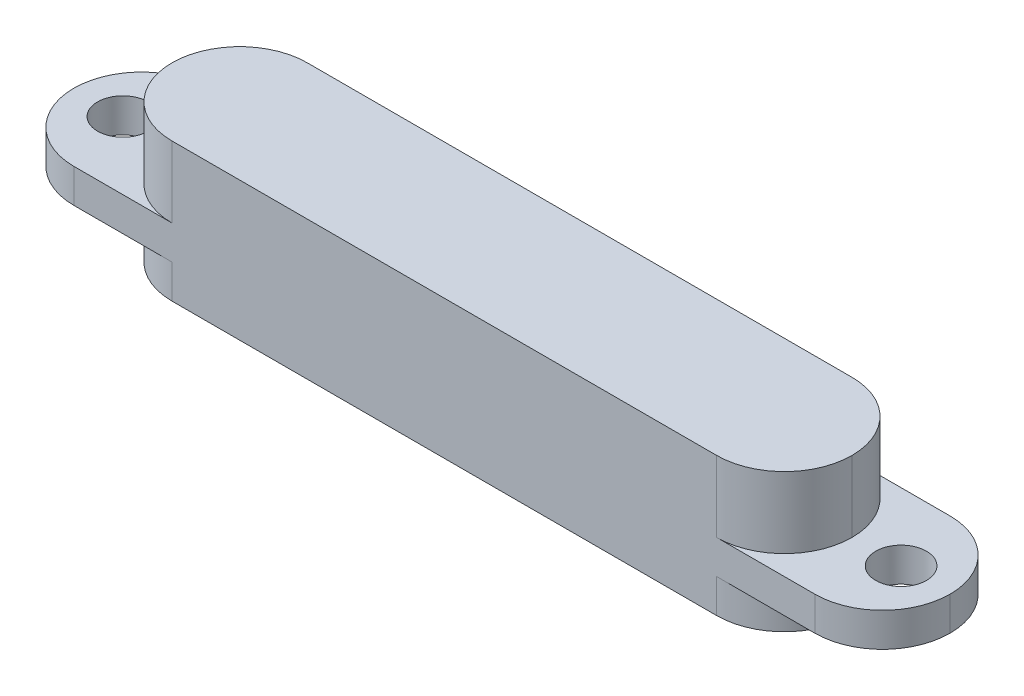
from build123d import *

# Parameters (mm, degrees)
SKETCH_1_W          = 20.1
SKETCH_1_H          = 4
EXTRUDE_1_DEPTH     = 2.1
SKETCH_1_3_W        = 25.9
SKETCH_1_3_H        = 4
EXTRUDE_2_DEPTH     = 1
EXTRUDE_START       = -1
SKETCH_1_4_W        = 20.1
SKETCH_1_4_H        = 4
EXTRUDE_4_DEPTH     = 1
FILLET_2_R          = 2
FILLET_1_R          = 2
SKETCH_2_R          = 0.75
CUT_EXTRUDE_1_DEPTH = 14.465233009
EXTRUDE_START_2     = -3.1
SKETCH_3_R          = 0.5
EXTRUDE_3_DEPTH     = 5.6


with BuildPart() as part:
    # 草图1 → 凸台-拉伸1 (new body)
    with BuildSketch(Plane(origin=(0, 0, 0), x_dir=(1, 0, 0), z_dir=(0, 1, 0))):
        Rectangle(SKETCH_1_W, SKETCH_1_H)
    extrude(amount=EXTRUDE_1_DEPTH)

    # 草图1<3> → 凸台-拉伸2 (add)
    with BuildSketch(Plane(origin=(0, 0, 0), x_dir=(1, 0, 0), z_dir=(0, 1, 0))):
        Rectangle(SKETCH_1_3_W, SKETCH_1_3_H)
    extrude(amount=-EXTRUDE_2_DEPTH)

    # 草图1<4> → 凸台-拉伸4 (add)
    with BuildSketch(Plane(origin=(0, 0, 0), x_dir=(1, 0, 0), z_dir=(0, 1, 0)).offset(EXTRUDE_START)):
        Rectangle(SKETCH_1_4_W, SKETCH_1_4_H)
    extrude(amount=-EXTRUDE_4_DEPTH)

    # 圆角2
    fillet_2_edges = [part.edges().sort_by_distance(p)[0] for p in [
        (12.95, -0.5, 2),
        (12.95, -0.5, -2),
        (-12.95, -0.5, 2),
        (-12.95, -0.5, -2),
    ]]
    fillet(fillet_2_edges, radius=FILLET_2_R - 0.0001)  # a hair under: the kernel refuses the full size

    # 圆角1
    fillet_1_edges = [part.edges().sort_by_distance(p)[0] for p in [
        (10.05, 1.05, -2),
        (10.05, 1.05, 2),
        (-10.05, 1.05, 2),
        (-10.05, 1.05, -2),
        (-10.05, -1.5, -2),
        (-10.05, -1.5, 2),
        (10.05, -1.5, 2),
        (10.05, -1.5, -2),
    ]]
    fillet(fillet_1_edges, radius=FILLET_1_R - 0.0001)  # a hair under: the kernel refuses the full size

    # 草图2 → 切除-拉伸1 (cut, through all)
    with BuildSketch(Plane(origin=(0, -1, 0), x_dir=(-1, 0, 0), z_dir=(0, -1, 0))):
        with Locations(Location((11.5, 0, 0), (0, 0, 90))):
            Circle(SKETCH_2_R)
        with Locations(Location((-11.5, 0, 0), (0, 0, 90))):
            Circle(SKETCH_2_R)
    extrude(amount=-CUT_EXTRUDE_1_DEPTH, mode=Mode.SUBTRACT)

    # 草图3 → 凸台-拉伸3 (add)
    with BuildSketch(Plane.XZ.offset(1).offset(EXTRUDE_START_2)):
        with Locations(Location((0, 0, 0), (0, 0, 90))):
            Circle(SKETCH_3_R)
        with Locations(Location((2.54, 0, 0), (0, 0, 90))):
            Circle(SKETCH_3_R)
        with Locations(Location((-2.54, 0, 0), (0, 0, 90))):
            Circle(SKETCH_3_R)
        with Locations(Location((-5.08, 0, 0), (0, 0, 90))):
            Circle(SKETCH_3_R)
        with Locations(Location((5.08, 0, 0), (0, 0, 90))):
            Circle(SKETCH_3_R)
    extrude(amount=EXTRUDE_3_DEPTH)


solid = part.part
